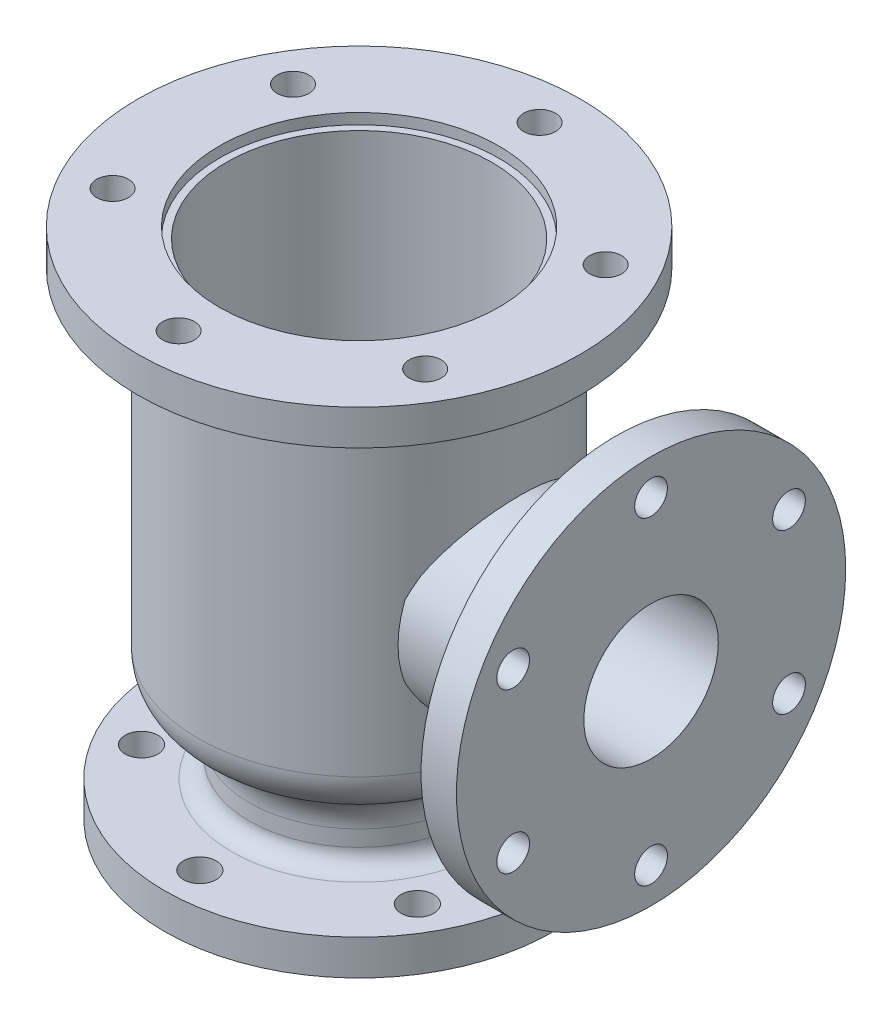
from build123d import *

# Parameters (mm, degrees)
SKETCH6_R           = 9.25
CUT_EXTRUDE9_DEPTH  = 20
SKETCH9_R           = 9
CUT_EXTRUDE10_DEPTH = 20
SKETCH10_R          = 38
CUT_EXTRUDE11_DEPTH = 340.632153955
SKETCH11_R          = 54
SKETCH11_R_2        = 38
BOSS_EXTRUDE1_DEPTH = 89
BOSS_EXTRUDE2_START = -20
SKETCH12_R          = 110
SKETCH12_R_2        = 38
BOSS_EXTRUDE2_DEPTH = 20
SKETCH13_R          = 9.25
CUT_EXTRUDE12_DEPTH = 20


# Read off the part's stored shape, not the designer's step: Revolve-Thin1
with BuildPart() as part:
    # Revolve-Thin1 outline → Revolve-Thin1 (revolve)
    with BuildSketch(Plane.XY):
        with BuildLine():
            ThreePointArc((46, 34), (44.535533906, 30.464466094), (41, 29))
            Line((41, 29), (38, 29))
            Line((38, 29), (38, 0))
            Line((38, 0), (110, 0))
            Line((110, 0), (110, 20))
            Line((110, 20), (72, 20))
            ThreePointArc((72, 20), (64.928932188, 22.928932188), (62, 30))
            Line((62, 30), (62, 38.989131719))
            ThreePointArc((62, 38.989131719), (65.850439211, 52.319400974), (76.215686275, 61.543478915))
            ThreePointArc((76.215686275, 61.543478915), (86.995543221, 71.136519974), (91, 85))
            Line((91, 85), (91, 260))
            ThreePointArc((91, 260), (93.928932188, 267.071067812), (101, 270))
            Line((101, 270), (125, 270))
            Line((125, 270), (125, 290))
            Line((125, 290), (79, 290))
            Line((79, 290), (79, 284))
            Line((79, 284), (75, 284))
            Line((75, 284), (75, 105))
            ThreePointArc((75, 105), (72.071067812, 97.928932188), (65, 95))
            Line((65, 95), (57, 95))
            Line((57, 95), (57, 85))
            Line((57, 85), (48, 85))
            Line((48, 85), (46, 83))
            Line((46, 83), (46, 34))
        make_face()
        with BuildLine():
            Line((90.4, 278.590320062), (90.4, 278.6))
            Line((90.4, 278.6), (90.416994756, 278.6))
            ThreePointArc((90.416994756, 278.6), (90.408496272, 278.595161972), (90.4, 278.590320062))
        make_face(mode=Mode.SUBTRACT)
    revolve(axis=Axis((0, 0, 0), (0, 1, 0)))

    # Sketch6 → Cut-Extrude9 (cut)
    with BuildSketch(Plane.XZ):
        with Locations(Location((0, 90, 0), (0, 0, 270))):
            Circle(SKETCH6_R)
        with Locations(Location((77.942286341, 45, 0), (0, 0, 270))):
            Circle(SKETCH6_R)
        with Locations(Location((77.942286341, -45, 0), (0, 0, 270))):
            Circle(SKETCH6_R)
        with Locations(Location((0, -90, 0), (0, 0, 270))):
            Circle(SKETCH6_R)
        with Locations(Location((-77.942286341, -45, 0), (0, 0, 270))):
            Circle(SKETCH6_R)
        with Locations(Location((-77.942286341, 45, 0), (0, 0, 270))):
            Circle(SKETCH6_R)
    extrude(amount=-CUT_EXTRUDE9_DEPTH, mode=Mode.SUBTRACT)

    # Sketch9 → Cut-Extrude10 (cut)
    with BuildSketch(Plane(origin=(0, 290, 0), x_dir=(1, 0, 0), z_dir=(0, 1, 0))):
        with Locations(Location((0, 102, 0), (0, 0, 270))):
            Circle(SKETCH9_R)
        with Locations(Location((88.334591186, 51, 0), (0, 0, 270))):
            Circle(SKETCH9_R)
        with Locations(Location((88.334591186, -51, 0), (0, 0, 270))):
            Circle(SKETCH9_R)
        with Locations(Location((0, -102, 0), (0, 0, 270))):
            Circle(SKETCH9_R)
        with Locations(Location((-88.334591186, -51, 0), (0, 0, 270))):
            Circle(SKETCH9_R)
        with Locations(Location((-88.334591186, 51, 0), (0, 0, 270))):
            Circle(SKETCH9_R)
    extrude(amount=-CUT_EXTRUDE10_DEPTH, mode=Mode.SUBTRACT)

    # Sketch10 → Cut-Extrude11 (cut, through all)
    with BuildSketch(Plane(origin=(0, 0, 0), x_dir=(0, 0, -1), z_dir=(1, 0, 0))):
        with Locations(Location((0, 150, 0), (0, 0, 180))):
            Circle(SKETCH10_R)
    extrude(amount=CUT_EXTRUDE11_DEPTH, mode=Mode.SUBTRACT)


with BuildPart() as body_2:
    # Sketch11 → Boss-Extrude1 (new body)
    with BuildSketch(Plane(origin=(76, 0, 0), x_dir=(0, 0, -1), z_dir=(1, 0, 0))):
        with Locations((0, 150)):
            Circle(SKETCH11_R)
        with Locations((0, 150)):
            Circle(SKETCH11_R_2, mode=Mode.SUBTRACT)
    extrude(amount=BOSS_EXTRUDE1_DEPTH)

    # Sketch12 → Boss-Extrude2 (add)
    with BuildSketch(Plane(origin=(165, 0, 0), x_dir=(0, 0, -1), z_dir=(1, 0, 0)).offset(BOSS_EXTRUDE2_START)):
        with Locations((0, 150)):
            Circle(SKETCH12_R)
        with Locations((0, 150)):
            Circle(SKETCH12_R_2, mode=Mode.SUBTRACT)
    extrude(amount=BOSS_EXTRUDE2_DEPTH)

    # Sketch13 → Cut-Extrude12 (cut)
    with BuildSketch(Plane(origin=(165, 0, 0), x_dir=(0, 0, -1), z_dir=(1, 0, 0))):
        with Locations((0, 240)):
            Circle(SKETCH13_R)
        with Locations((77.942286341, 195)):
            Circle(SKETCH13_R)
        with Locations((77.942286341, 105)):
            Circle(SKETCH13_R)
        with Locations((0, 60)):
            Circle(SKETCH13_R)
        with Locations((-77.942286341, 105)):
            Circle(SKETCH13_R)
        with Locations((-77.942286341, 195)):
            Circle(SKETCH13_R)
    extrude(amount=-CUT_EXTRUDE12_DEPTH, mode=Mode.SUBTRACT)


solid = Compound([part.part, body_2.part])
